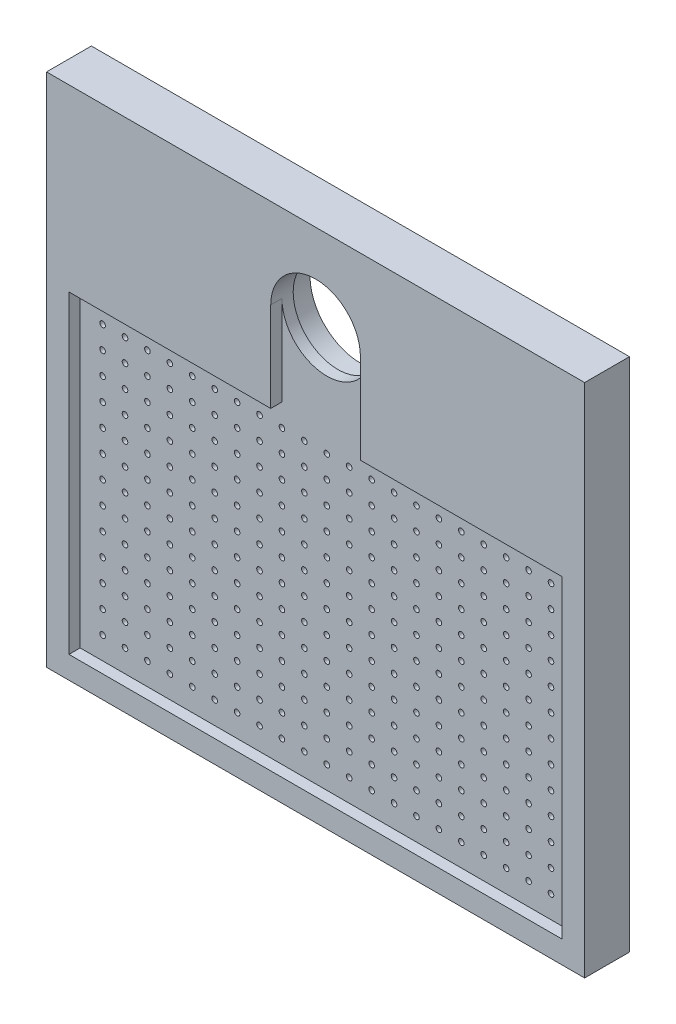
from build123d import *

# Parameters (mm, degrees)
SKETCH1_W           = 304.8
SKETCH1_H           = 292.1
BOSS_EXTRUDE1_DEPTH = 25.4
SKETCH2_W           = 279.4
SKETCH2_H           = 177.8
CUT_EXTRUDE1_DEPTH  = 6.35
SKETCH3_R           = 1.5875
CUT_EXTRUDE3_DEPTH  = 423.930975456
CUT_EXTRUDE11_DEPTH = 6.35
SKETCH12_R          = 25.4
CUT_EXTRUDE12_DEPTH = 12.7
SKETCH13_R          = 28.575
CUT_EXTRUDE16_DEPTH = 12.7


with BuildPart() as part:
    # Sketch1 → Boss-Extrude1 (new body)
    with BuildSketch(Plane.XY):
        with Locations((152.4, 146.05)):
            Rectangle(SKETCH1_W, SKETCH1_H)
    extrude(amount=-BOSS_EXTRUDE1_DEPTH)

    # Sketch2 → Cut-Extrude1 (cut)
    with BuildSketch(Plane.XY):
        with Locations((152.4, 101.6)):
            Rectangle(SKETCH2_W, SKETCH2_H)
    extrude(amount=-CUT_EXTRUDE1_DEPTH, mode=Mode.SUBTRACT)

    # Sketch3 → Cut-Extrude3 (cut, through all)
    with BuildSketch(Plane(origin=(0, 0, -25.4), x_dir=(-1, 0, 0), z_dir=(0, 0, -1))):
        with Locations((-279.4, 177.8)):
            Circle(SKETCH3_R)
        with Locations((-266.7, 177.8)):
            Circle(SKETCH3_R)
        with Locations((-254, 177.8)):
            Circle(SKETCH3_R)
        with Locations((-241.3, 177.8)):
            Circle(SKETCH3_R)
        with Locations((-228.6, 177.8)):
            Circle(SKETCH3_R)
        with Locations((-215.9, 177.8)):
            Circle(SKETCH3_R)
        with Locations((-203.2, 177.8)):
            Circle(SKETCH3_R)
        with Locations((-190.5, 177.8)):
            Circle(SKETCH3_R)
        with Locations((-177.8, 177.8)):
            Circle(SKETCH3_R)
        with Locations((-266.7, 165.1)):
            Circle(SKETCH3_R)
        with Locations((-254, 165.1)):
            Circle(SKETCH3_R)
        with Locations((-241.3, 165.1)):
            Circle(SKETCH3_R)
        with Locations((-228.6, 165.1)):
            Circle(SKETCH3_R)
        with Locations((-215.9, 165.1)):
            Circle(SKETCH3_R)
        with Locations((-203.2, 165.1)):
            Circle(SKETCH3_R)
        with Locations((-190.5, 165.1)):
            Circle(SKETCH3_R)
        with Locations((-177.8, 165.1)):
            Circle(SKETCH3_R)
        with Locations((-266.7, 152.4)):
            Circle(SKETCH3_R)
        with Locations((-254, 152.4)):
            Circle(SKETCH3_R)
        with Locations((-241.3, 152.4)):
            Circle(SKETCH3_R)
        with Locations((-228.6, 152.4)):
            Circle(SKETCH3_R)
        with Locations((-215.9, 152.4)):
            Circle(SKETCH3_R)
        with Locations((-203.2, 152.4)):
            Circle(SKETCH3_R)
        with Locations((-190.5, 152.4)):
            Circle(SKETCH3_R)
        with Locations((-177.8, 152.4)):
            Circle(SKETCH3_R)
        with Locations((-266.7, 139.7)):
            Circle(SKETCH3_R)
        with Locations((-254, 139.7)):
            Circle(SKETCH3_R)
        with Locations((-241.3, 139.7)):
            Circle(SKETCH3_R)
        with Locations((-228.6, 139.7)):
            Circle(SKETCH3_R)
        with Locations((-215.9, 139.7)):
            Circle(SKETCH3_R)
        with Locations((-203.2, 139.7)):
            Circle(SKETCH3_R)
        with Locations((-190.5, 139.7)):
            Circle(SKETCH3_R)
        with Locations((-177.8, 139.7)):
            Circle(SKETCH3_R)
        with Locations((-266.7, 127)):
            Circle(SKETCH3_R)
        with Locations((-254, 127)):
            Circle(SKETCH3_R)
        with Locations((-241.3, 127)):
            Circle(SKETCH3_R)
        with Locations((-228.6, 127)):
            Circle(SKETCH3_R)
        with Locations((-215.9, 127)):
            Circle(SKETCH3_R)
        with Locations((-203.2, 127)):
            Circle(SKETCH3_R)
        with Locations((-190.5, 127)):
            Circle(SKETCH3_R)
        with Locations((-177.8, 127)):
            Circle(SKETCH3_R)
        with Locations((-266.7, 114.3)):
            Circle(SKETCH3_R)
        with Locations((-254, 114.3)):
            Circle(SKETCH3_R)
        with Locations((-241.3, 114.3)):
            Circle(SKETCH3_R)
        with Locations((-228.6, 114.3)):
            Circle(SKETCH3_R)
        with Locations((-215.9, 114.3)):
            Circle(SKETCH3_R)
        with Locations((-203.2, 114.3)):
            Circle(SKETCH3_R)
        with Locations((-190.5, 114.3)):
            Circle(SKETCH3_R)
        with Locations((-177.8, 114.3)):
            Circle(SKETCH3_R)
        with Locations((-165.1, 177.8)):
            Circle(SKETCH3_R)
        with Locations((-152.4, 177.8)):
            Circle(SKETCH3_R)
        with Locations((-139.7, 177.8)):
            Circle(SKETCH3_R)
        with Locations((-127, 177.8)):
            Circle(SKETCH3_R)
        with Locations((-114.3, 177.8)):
            Circle(SKETCH3_R)
        with Locations((-101.6, 177.8)):
            Circle(SKETCH3_R)
        with Locations((-88.9, 177.8)):
            Circle(SKETCH3_R)
        with Locations((-76.2, 177.8)):
            Circle(SKETCH3_R)
        with Locations((-63.5, 177.8)):
            Circle(SKETCH3_R)
        with Locations((-165.1, 165.1)):
            Circle(SKETCH3_R)
        with Locations((-152.4, 165.1)):
            Circle(SKETCH3_R)
        with Locations((-139.7, 165.1)):
            Circle(SKETCH3_R)
        with Locations((-127, 165.1)):
            Circle(SKETCH3_R)
        with Locations((-114.3, 165.1)):
            Circle(SKETCH3_R)
        with Locations((-101.6, 165.1)):
            Circle(SKETCH3_R)
        with Locations((-88.9, 165.1)):
            Circle(SKETCH3_R)
        with Locations((-76.2, 165.1)):
            Circle(SKETCH3_R)
        with Locations((-63.5, 165.1)):
            Circle(SKETCH3_R)
        with Locations((-165.1, 152.4)):
            Circle(SKETCH3_R)
        with Locations((-152.4, 152.4)):
            Circle(SKETCH3_R)
        with Locations((-139.7, 152.4)):
            Circle(SKETCH3_R)
        with Locations((-127, 152.4)):
            Circle(SKETCH3_R)
        with Locations((-114.3, 152.4)):
            Circle(SKETCH3_R)
        with Locations((-101.6, 152.4)):
            Circle(SKETCH3_R)
        with Locations((-279.4, 165.1)):
            Circle(SKETCH3_R)
        with Locations((-279.4, 152.4)):
            Circle(SKETCH3_R)
        with Locations((-279.4, 139.7)):
            Circle(SKETCH3_R)
        with Locations((-279.4, 127)):
            Circle(SKETCH3_R)
        with Locations((-279.4, 114.3)):
            Circle(SKETCH3_R)
        with Locations((-88.9, 152.4)):
            Circle(SKETCH3_R)
        with Locations((-76.2, 152.4)):
            Circle(SKETCH3_R)
        with Locations((-63.5, 152.4)):
            Circle(SKETCH3_R)
        with Locations((-165.1, 139.7)):
            Circle(SKETCH3_R)
        with Locations((-152.4, 139.7)):
            Circle(SKETCH3_R)
        with Locations((-139.7, 139.7)):
            Circle(SKETCH3_R)
        with Locations((-127, 139.7)):
            Circle(SKETCH3_R)
        with Locations((-114.3, 139.7)):
            Circle(SKETCH3_R)
        with Locations((-101.6, 139.7)):
            Circle(SKETCH3_R)
        with Locations((-88.9, 139.7)):
            Circle(SKETCH3_R)
        with Locations((-76.2, 139.7)):
            Circle(SKETCH3_R)
        with Locations((-63.5, 139.7)):
            Circle(SKETCH3_R)
        with Locations((-165.1, 127)):
            Circle(SKETCH3_R)
        with Locations((-152.4, 127)):
            Circle(SKETCH3_R)
        with Locations((-139.7, 127)):
            Circle(SKETCH3_R)
        with Locations((-127, 127)):
            Circle(SKETCH3_R)
        with Locations((-114.3, 127)):
            Circle(SKETCH3_R)
        with Locations((-101.6, 127)):
            Circle(SKETCH3_R)
        with Locations((-88.9, 127)):
            Circle(SKETCH3_R)
        with Locations((-76.2, 127)):
            Circle(SKETCH3_R)
        with Locations((-63.5, 127)):
            Circle(SKETCH3_R)
        with Locations((-165.1, 114.3)):
            Circle(SKETCH3_R)
        with Locations((-152.4, 114.3)):
            Circle(SKETCH3_R)
        with Locations((-139.7, 114.3)):
            Circle(SKETCH3_R)
        with Locations((-127, 114.3)):
            Circle(SKETCH3_R)
        with Locations((-114.3, 114.3)):
            Circle(SKETCH3_R)
        with Locations((-101.6, 114.3)):
            Circle(SKETCH3_R)
        with Locations((-88.9, 114.3)):
            Circle(SKETCH3_R)
        with Locations((-76.2, 114.3)):
            Circle(SKETCH3_R)
        with Locations((-63.5, 114.3)):
            Circle(SKETCH3_R)
        with Locations((-279.4, 101.6)):
            Circle(SKETCH3_R)
        with Locations((-266.7, 101.6)):
            Circle(SKETCH3_R)
        with Locations((-254, 101.6)):
            Circle(SKETCH3_R)
        with Locations((-241.3, 101.6)):
            Circle(SKETCH3_R)
        with Locations((-228.6, 101.6)):
            Circle(SKETCH3_R)
        with Locations((-215.9, 101.6)):
            Circle(SKETCH3_R)
        with Locations((-203.2, 101.6)):
            Circle(SKETCH3_R)
        with Locations((-190.5, 101.6)):
            Circle(SKETCH3_R)
        with Locations((-177.8, 101.6)):
            Circle(SKETCH3_R)
        with Locations((-165.1, 101.6)):
            Circle(SKETCH3_R)
        with Locations((-152.4, 101.6)):
            Circle(SKETCH3_R)
        with Locations((-139.7, 101.6)):
            Circle(SKETCH3_R)
        with Locations((-127, 101.6)):
            Circle(SKETCH3_R)
        with Locations((-114.3, 101.6)):
            Circle(SKETCH3_R)
        with Locations((-101.6, 101.6)):
            Circle(SKETCH3_R)
        with Locations((-88.9, 101.6)):
            Circle(SKETCH3_R)
        with Locations((-76.2, 101.6)):
            Circle(SKETCH3_R)
        with Locations((-63.5, 101.6)):
            Circle(SKETCH3_R)
        with Locations((-279.4, 88.9)):
            Circle(SKETCH3_R)
        with Locations((-266.7, 88.9)):
            Circle(SKETCH3_R)
        with Locations((-254, 88.9)):
            Circle(SKETCH3_R)
        with Locations((-241.3, 88.9)):
            Circle(SKETCH3_R)
        with Locations((-228.6, 88.9)):
            Circle(SKETCH3_R)
        with Locations((-215.9, 88.9)):
            Circle(SKETCH3_R)
        with Locations((-203.2, 88.9)):
            Circle(SKETCH3_R)
        with Locations((-190.5, 88.9)):
            Circle(SKETCH3_R)
        with Locations((-177.8, 88.9)):
            Circle(SKETCH3_R)
        with Locations((-165.1, 88.9)):
            Circle(SKETCH3_R)
        with Locations((-152.4, 88.9)):
            Circle(SKETCH3_R)
        with Locations((-139.7, 88.9)):
            Circle(SKETCH3_R)
        with Locations((-127, 88.9)):
            Circle(SKETCH3_R)
        with Locations((-114.3, 88.9)):
            Circle(SKETCH3_R)
        with Locations((-101.6, 88.9)):
            Circle(SKETCH3_R)
        with Locations((-88.9, 88.9)):
            Circle(SKETCH3_R)
        with Locations((-76.2, 88.9)):
            Circle(SKETCH3_R)
        with Locations((-63.5, 88.9)):
            Circle(SKETCH3_R)
        with Locations((-279.4, 76.2)):
            Circle(SKETCH3_R)
        with Locations((-266.7, 76.2)):
            Circle(SKETCH3_R)
        with Locations((-254, 76.2)):
            Circle(SKETCH3_R)
        with Locations((-241.3, 76.2)):
            Circle(SKETCH3_R)
        with Locations((-228.6, 76.2)):
            Circle(SKETCH3_R)
        with Locations((-215.9, 76.2)):
            Circle(SKETCH3_R)
        with Locations((-203.2, 76.2)):
            Circle(SKETCH3_R)
        with Locations((-190.5, 76.2)):
            Circle(SKETCH3_R)
        with Locations((-177.8, 76.2)):
            Circle(SKETCH3_R)
        with Locations((-165.1, 76.2)):
            Circle(SKETCH3_R)
        with Locations((-152.4, 76.2)):
            Circle(SKETCH3_R)
        with Locations((-139.7, 76.2)):
            Circle(SKETCH3_R)
        with Locations((-127, 76.2)):
            Circle(SKETCH3_R)
        with Locations((-114.3, 76.2)):
            Circle(SKETCH3_R)
        with Locations((-101.6, 76.2)):
            Circle(SKETCH3_R)
        with Locations((-88.9, 76.2)):
            Circle(SKETCH3_R)
        with Locations((-76.2, 76.2)):
            Circle(SKETCH3_R)
        with Locations((-63.5, 76.2)):
            Circle(SKETCH3_R)
        with Locations((-279.4, 63.5)):
            Circle(SKETCH3_R)
        with Locations((-266.7, 63.5)):
            Circle(SKETCH3_R)
        with Locations((-254, 63.5)):
            Circle(SKETCH3_R)
        with Locations((-241.3, 63.5)):
            Circle(SKETCH3_R)
        with Locations((-228.6, 63.5)):
            Circle(SKETCH3_R)
        with Locations((-215.9, 63.5)):
            Circle(SKETCH3_R)
        with Locations((-203.2, 63.5)):
            Circle(SKETCH3_R)
        with Locations((-190.5, 63.5)):
            Circle(SKETCH3_R)
        with Locations((-177.8, 63.5)):
            Circle(SKETCH3_R)
        with Locations((-165.1, 63.5)):
            Circle(SKETCH3_R)
        with Locations((-152.4, 63.5)):
            Circle(SKETCH3_R)
        with Locations((-139.7, 63.5)):
            Circle(SKETCH3_R)
        with Locations((-127, 63.5)):
            Circle(SKETCH3_R)
        with Locations((-114.3, 63.5)):
            Circle(SKETCH3_R)
        with Locations((-101.6, 63.5)):
            Circle(SKETCH3_R)
        with Locations((-88.9, 63.5)):
            Circle(SKETCH3_R)
        with Locations((-76.2, 63.5)):
            Circle(SKETCH3_R)
        with Locations((-63.5, 63.5)):
            Circle(SKETCH3_R)
        with Locations((-279.4, 50.8)):
            Circle(SKETCH3_R)
        with Locations((-266.7, 50.8)):
            Circle(SKETCH3_R)
        with Locations((-254, 50.8)):
            Circle(SKETCH3_R)
        with Locations((-241.3, 50.8)):
            Circle(SKETCH3_R)
        with Locations((-228.6, 50.8)):
            Circle(SKETCH3_R)
        with Locations((-215.9, 50.8)):
            Circle(SKETCH3_R)
        with Locations((-203.2, 50.8)):
            Circle(SKETCH3_R)
        with Locations((-190.5, 50.8)):
            Circle(SKETCH3_R)
        with Locations((-177.8, 50.8)):
            Circle(SKETCH3_R)
        with Locations((-165.1, 50.8)):
            Circle(SKETCH3_R)
        with Locations((-152.4, 50.8)):
            Circle(SKETCH3_R)
        with Locations((-139.7, 50.8)):
            Circle(SKETCH3_R)
        with Locations((-127, 50.8)):
            Circle(SKETCH3_R)
        with Locations((-114.3, 50.8)):
            Circle(SKETCH3_R)
        with Locations((-101.6, 50.8)):
            Circle(SKETCH3_R)
        with Locations((-88.9, 50.8)):
            Circle(SKETCH3_R)
        with Locations((-76.2, 50.8)):
            Circle(SKETCH3_R)
        with Locations((-63.5, 50.8)):
            Circle(SKETCH3_R)
        with Locations((-279.4, 38.1)):
            Circle(SKETCH3_R)
        with Locations((-266.7, 38.1)):
            Circle(SKETCH3_R)
        with Locations((-254, 38.1)):
            Circle(SKETCH3_R)
        with Locations((-241.3, 38.1)):
            Circle(SKETCH3_R)
        with Locations((-228.6, 38.1)):
            Circle(SKETCH3_R)
        with Locations((-215.9, 38.1)):
            Circle(SKETCH3_R)
        with Locations((-203.2, 38.1)):
            Circle(SKETCH3_R)
        with Locations((-190.5, 38.1)):
            Circle(SKETCH3_R)
        with Locations((-177.8, 38.1)):
            Circle(SKETCH3_R)
        with Locations((-165.1, 38.1)):
            Circle(SKETCH3_R)
        with Locations((-152.4, 38.1)):
            Circle(SKETCH3_R)
        with Locations((-139.7, 38.1)):
            Circle(SKETCH3_R)
        with Locations((-127, 38.1)):
            Circle(SKETCH3_R)
        with Locations((-114.3, 38.1)):
            Circle(SKETCH3_R)
        with Locations((-101.6, 38.1)):
            Circle(SKETCH3_R)
        with Locations((-88.9, 38.1)):
            Circle(SKETCH3_R)
        with Locations((-76.2, 38.1)):
            Circle(SKETCH3_R)
        with Locations((-63.5, 38.1)):
            Circle(SKETCH3_R)
        with Locations((-50.8, 177.8)):
            Circle(SKETCH3_R)
        with Locations((-38.1, 177.8)):
            Circle(SKETCH3_R)
        with Locations((-50.8, 165.1)):
            Circle(SKETCH3_R)
        with Locations((-38.1, 165.1)):
            Circle(SKETCH3_R)
        with Locations((-50.8, 152.4)):
            Circle(SKETCH3_R)
        with Locations((-38.1, 152.4)):
            Circle(SKETCH3_R)
        with Locations((-50.8, 139.7)):
            Circle(SKETCH3_R)
        with Locations((-38.1, 139.7)):
            Circle(SKETCH3_R)
        with Locations((-50.8, 127)):
            Circle(SKETCH3_R)
        with Locations((-38.1, 127)):
            Circle(SKETCH3_R)
        with Locations((-50.8, 114.3)):
            Circle(SKETCH3_R)
        with Locations((-38.1, 114.3)):
            Circle(SKETCH3_R)
        with Locations((-50.8, 101.6)):
            Circle(SKETCH3_R)
        with Locations((-38.1, 101.6)):
            Circle(SKETCH3_R)
        with Locations((-50.8, 88.9)):
            Circle(SKETCH3_R)
        with Locations((-38.1, 88.9)):
            Circle(SKETCH3_R)
        with Locations((-50.8, 76.2)):
            Circle(SKETCH3_R)
        with Locations((-38.1, 76.2)):
            Circle(SKETCH3_R)
        with Locations((-50.8, 63.5)):
            Circle(SKETCH3_R)
        with Locations((-38.1, 63.5)):
            Circle(SKETCH3_R)
        with Locations((-50.8, 50.8)):
            Circle(SKETCH3_R)
        with Locations((-38.1, 50.8)):
            Circle(SKETCH3_R)
        with Locations((-50.8, 38.1)):
            Circle(SKETCH3_R)
        with Locations((-38.1, 38.1)):
            Circle(SKETCH3_R)
        with Locations((-25.4, 177.8)):
            Circle(SKETCH3_R)
        with Locations((-25.4, 165.1)):
            Circle(SKETCH3_R)
        with Locations((-25.4, 152.4)):
            Circle(SKETCH3_R)
        with Locations((-25.4, 139.7)):
            Circle(SKETCH3_R)
        with Locations((-25.4, 127)):
            Circle(SKETCH3_R)
        with Locations((-25.4, 114.3)):
            Circle(SKETCH3_R)
        with Locations((-25.4, 101.6)):
            Circle(SKETCH3_R)
        with Locations((-25.4, 88.9)):
            Circle(SKETCH3_R)
        with Locations((-25.4, 76.2)):
            Circle(SKETCH3_R)
        with Locations((-25.4, 63.5)):
            Circle(SKETCH3_R)
        with Locations((-25.4, 50.8)):
            Circle(SKETCH3_R)
        with Locations((-25.4, 38.1)):
            Circle(SKETCH3_R)
        with Locations((-279.4, 25.4)):
            Circle(SKETCH3_R)
        with Locations((-266.7, 25.4)):
            Circle(SKETCH3_R)
        with Locations((-254, 25.4)):
            Circle(SKETCH3_R)
        with Locations((-241.3, 25.4)):
            Circle(SKETCH3_R)
        with Locations((-228.6, 25.4)):
            Circle(SKETCH3_R)
        with Locations((-215.9, 25.4)):
            Circle(SKETCH3_R)
        with Locations((-203.2, 25.4)):
            Circle(SKETCH3_R)
        with Locations((-190.5, 25.4)):
            Circle(SKETCH3_R)
        with Locations((-177.8, 25.4)):
            Circle(SKETCH3_R)
        with Locations((-165.1, 25.4)):
            Circle(SKETCH3_R)
        with Locations((-152.4, 25.4)):
            Circle(SKETCH3_R)
        with Locations((-139.7, 25.4)):
            Circle(SKETCH3_R)
        with Locations((-127, 25.4)):
            Circle(SKETCH3_R)
        with Locations((-114.3, 25.4)):
            Circle(SKETCH3_R)
        with Locations((-101.6, 25.4)):
            Circle(SKETCH3_R)
        with Locations((-88.9, 25.4)):
            Circle(SKETCH3_R)
        with Locations((-76.2, 25.4)):
            Circle(SKETCH3_R)
        with Locations((-63.5, 25.4)):
            Circle(SKETCH3_R)
        with Locations((-50.8, 25.4)):
            Circle(SKETCH3_R)
        with Locations((-38.1, 25.4)):
            Circle(SKETCH3_R)
        with Locations((-25.4, 25.4)):
            Circle(SKETCH3_R)
    extrude(amount=-CUT_EXTRUDE3_DEPTH, mode=Mode.SUBTRACT)

    # Sketch11 → Cut-Extrude11 (cut)
    with BuildSketch(Plane.XY):
        with BuildLine():
            Line((177.8, 241.3), (177.8, 190.5))
            Line((177.8, 190.5), (127, 190.5))
            Line((127, 190.5), (127, 241.3))
            ThreePointArc((127, 241.3), (152.4, 266.7), (177.8, 241.3))
        make_face()
    extrude(amount=-CUT_EXTRUDE11_DEPTH, mode=Mode.SUBTRACT)

    # Sketch12 → Cut-Extrude12 (cut)
    with BuildSketch(Plane.XY.offset(-6.35)):
        with Locations((152.4, 241.3)):
            Circle(SKETCH12_R)
    extrude(amount=-CUT_EXTRUDE12_DEPTH, mode=Mode.SUBTRACT)

    # Sketch13 → Cut-Extrude16 (cut)
    with BuildSketch(Plane(origin=(0, 0, -25.4), x_dir=(-1, 0, 0), z_dir=(0, 0, -1))):
        with Locations((-152.4, 241.3)):
            Circle(SKETCH13_R)
    extrude(amount=-CUT_EXTRUDE16_DEPTH, mode=Mode.SUBTRACT)


solid = part.part
